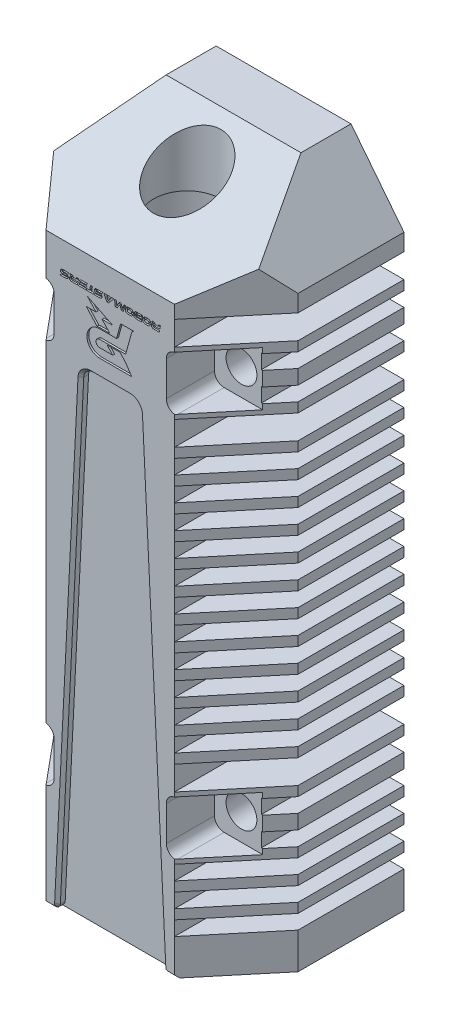
from build123d import *

# Parameters (mm, degrees)
SKETCH_1_W             = 25
SKETCH_1_H             = 20
EXTRUDE_2_DEPTH        = 42.5
SKETCH_3_R             = 6.025
CUT_EXTRUDE_2_DEPTH    = 65
CUT_EXTRUDE_3_DEPTH    = 87.49421946
SKETCH_5_R             = 1.6
CUT_EXTRUDE_4_DEPTH    = 50
SKETCH_8_R             = 3.5
CUT_EXTRUDE_8_DEPTH    = 50
SKETCH_12_W            = 25
SKETCH_12_H            = 4
CUT_EXTRUDE_12_DEPTH   = 49.605555238
CUT_EXTRUDE_14_DEPTH   = 83.566639752
CUT_EXTRUDE_15_DEPTH   = 51.311529494
SKETCH_15_W            = 25
SKETCH_15_H            = 3
CUT_EXTRUDE_19_DEPTH   = 10
CUT_EXTRUDE_22_DEPTH   = 45.300112867
SKETCH_22_W            = 5.833333333
SKETCH_22_H            = 1.5
CUT_EXTRUDE_26_DEPTH   = 45.300112867
SKETCH_23_R            = 7
SKETCH_23_R_2          = 6.025
CUT_EXTRUDE_27_DEPTH   = 2.5
CHAMFER_2_SIZE         = 0.3
CUT_EXTRUDE_START      = -0.2
CUT_EXTRUDE_31_DEPTH   = 0.2
CUT_EXTRUDE_32_DEPTH   = 0.8
FILLET_4_R             = 1
FILLET_5_R             = 0.5
SKETCH_31_W            = 5.833333333
SKETCH_31_H            = 1
CUT_EXTRUDE_33_DEPTH   = 45.300112994
CUT_EXTRUDE_START_2    = -13
SKETCH_35_W            = 5.6
SKETCH_35_H            = 5.6
CUT_EXTRUDE_35_DEPTH   = 15
FILLET_6_R             = 1
CHAMFER_3_SIZE         = 0.3
CUT_EXTRUDE_36_DEPTH   = 4
EXTRUDE_START          = 1.5
EXTRUDE_3_DEPTH        = 1
PATTERN_LINEAR_1_COUNT = 2
PATTERN_LINEAR_1_PITCH = 2.5
CHAMFER_4_SIZE         = 0.3
SKETCH_39_W            = 1.8
SKETCH_39_H            = 1.5
CUT_EXTRUDE_37_DEPTH   = 45.300112907


# Read off the part's stored shape, not the designer's step: 切除-拉伸31
with BuildPart() as part:
    # 草图1 → 凸台-拉伸2 (new, symmetric)
    with BuildSketch(Plane(origin=(0, 0, 0), x_dir=(1, 0, 0), z_dir=(0, 1, 0))):
        Rectangle(SKETCH_1_W, SKETCH_1_H)
    extrude(amount=EXTRUDE_2_DEPTH, both=True)

    # 草图3 → 切除-拉伸2 (cut)
    with BuildSketch(Plane.XZ.offset(42.5)):
        with Locations(Location((0, 0, 0), (0, 0, 270))):
            Circle(SKETCH_3_R)
    extrude(amount=-CUT_EXTRUDE_2_DEPTH, mode=Mode.SUBTRACT)

    # 草图4 → 切除-拉伸3 (cut, through all)
    with BuildSketch(Plane.XZ.offset(42.5)):
        Polygon((5, 10), (12.5, 1), (12.5, 10), align=None)
        Polygon((-12.5, 10), (-5, 10), (-12.5, 1), align=None)
    extrude(amount=-CUT_EXTRUDE_3_DEPTH, mode=Mode.SUBTRACT)

    # 草图5 → 切除-拉伸4 (cut)
    with BuildSketch(Plane(origin=(0, 0, -10), x_dir=(-1, 0, 0), z_dir=(0, 0, -1))):
        with Locations((-8.625, -25)):
            Circle(SKETCH_5_R)
        with Locations((8.625, -25)):
            Circle(SKETCH_5_R)
        with Locations((-8.625, 15)):
            Circle(SKETCH_5_R)
        with Locations((8.625, 15)):
            Circle(SKETCH_5_R)
    extrude(amount=-CUT_EXTRUDE_4_DEPTH, mode=Mode.SUBTRACT)

    # 草图8 → 切除-拉伸8 (cut)
    with BuildSketch(Plane.XZ.offset(-22.5)):
        with Locations(Location((0, 0, 0), (0, 0, 270))):
            Circle(SKETCH_8_R)
    extrude(amount=-CUT_EXTRUDE_8_DEPTH, mode=Mode.SUBTRACT)

    # 草图12 → 切除-拉伸12 (cut, through all)
    with BuildSketch(Plane(origin=(0, 0, -10), x_dir=(-1, 0, 0), z_dir=(0, 0, -1))):
        with Locations((0, -40.5)):
            Rectangle(SKETCH_12_W, SKETCH_12_H)
    extrude(amount=-CUT_EXTRUDE_12_DEPTH, mode=Mode.SUBTRACT)

    # 草图14 → 切除-拉伸14 (cut, through all)
    with BuildSketch(Plane.XZ.offset(38.5)):
        Polygon((-6.666666667, 8), (6.666666667, 8), (5, 10), (-5, 10), align=None)
    extrude(amount=-CUT_EXTRUDE_14_DEPTH, mode=Mode.SUBTRACT)

    # 草图2 → 切除-拉伸15 (cut, through all)
    with BuildSketch(Plane.ZY.offset(12.5)):
        Polygon((-10, 32.5), (10, 20.952994616), (10, 42.5), (-10, 42.5), align=None)
    extrude(amount=-CUT_EXTRUDE_15_DEPTH, mode=Mode.SUBTRACT)

    # 草图15 → 切除-拉伸19 (cut)
    with BuildSketch(Plane(origin=(0, 0, -10), x_dir=(-1, 0, 0), z_dir=(0, 0, -1))):
        with Locations((0, 31)):
            Rectangle(SKETCH_15_W, SKETCH_15_H)
    extrude(amount=-CUT_EXTRUDE_19_DEPTH, mode=Mode.SUBTRACT)

    # 草图19 → 切除-拉伸22 (cut, through all)
    with BuildSketch(Plane(origin=(0, 0, -10), x_dir=(-1, 0, 0), z_dir=(0, 0, -1))):
        Polygon((12.5, 22.5), (7, 29.5), (12.5, 29.5), align=None)
        Polygon((-7, 29.5), (-12.5, 29.5), (-12.5, 22.5), align=None)
    extrude(amount=-CUT_EXTRUDE_22_DEPTH, mode=Mode.SUBTRACT)

    # 草图22 → 切除-拉伸26 (cut, through all)
    with BuildSketch(Plane(origin=(0, 0, -10), x_dir=(-1, 0, 0), z_dir=(0, 0, -1))):
        with Locations((9.583333334, 20)):
            Rectangle(SKETCH_22_W, SKETCH_22_H)
        with Locations((-9.583333334, -32.5)):
            Rectangle(SKETCH_22_W, SKETCH_22_H)
        with Locations((-9.583333334, -30)):
            Rectangle(SKETCH_22_W, SKETCH_22_H)
        with Locations((-9.583333334, -20)):
            Rectangle(SKETCH_22_W, SKETCH_22_H)
        with Locations((9.583333334, 10)):
            Rectangle(SKETCH_22_W, SKETCH_22_H)
        with Locations((9.583333334, 7.5)):
            Rectangle(SKETCH_22_W, SKETCH_22_H)
        with Locations((9.583333334, 5)):
            Rectangle(SKETCH_22_W, SKETCH_22_H)
        with Locations((9.583333334, 2.5)):
            Rectangle(SKETCH_22_W, SKETCH_22_H)
        with Locations((9.583333334, 0)):
            Rectangle(SKETCH_22_W, SKETCH_22_H)
        with Locations((9.583333334, -2.5)):
            Rectangle(SKETCH_22_W, SKETCH_22_H)
        with Locations((9.583333334, -5)):
            Rectangle(SKETCH_22_W, SKETCH_22_H)
        with Locations((9.583333334, -7.5)):
            Rectangle(SKETCH_22_W, SKETCH_22_H)
        with Locations((9.583333334, -10)):
            Rectangle(SKETCH_22_W, SKETCH_22_H)
        with Locations((9.583333334, -12.5)):
            Rectangle(SKETCH_22_W, SKETCH_22_H)
        with Locations((9.583333334, -15)):
            Rectangle(SKETCH_22_W, SKETCH_22_H)
        with Locations((9.583333334, -17.5)):
            Rectangle(SKETCH_22_W, SKETCH_22_H)
        with Locations((9.583333334, -20)):
            Rectangle(SKETCH_22_W, SKETCH_22_H)
        with Locations((-9.583333334, -17.5)):
            Rectangle(SKETCH_22_W, SKETCH_22_H)
        with Locations((-9.583333334, -15)):
            Rectangle(SKETCH_22_W, SKETCH_22_H)
        with Locations((-9.583333334, -12.5)):
            Rectangle(SKETCH_22_W, SKETCH_22_H)
        with Locations((9.583333334, -30)):
            Rectangle(SKETCH_22_W, SKETCH_22_H)
        with Locations((9.583333334, -32.5)):
            Rectangle(SKETCH_22_W, SKETCH_22_H)
        with Locations((-9.583333334, -10)):
            Rectangle(SKETCH_22_W, SKETCH_22_H)
        with Locations((-9.583333334, -7.5)):
            Rectangle(SKETCH_22_W, SKETCH_22_H)
        with Locations((-9.583333334, -5)):
            Rectangle(SKETCH_22_W, SKETCH_22_H)
        with Locations((-9.583333334, -2.5)):
            Rectangle(SKETCH_22_W, SKETCH_22_H)
        with Locations((-9.583333334, 0)):
            Rectangle(SKETCH_22_W, SKETCH_22_H)
        with Locations((-9.583333334, 2.5)):
            Rectangle(SKETCH_22_W, SKETCH_22_H)
        with Locations((-9.583333334, 5)):
            Rectangle(SKETCH_22_W, SKETCH_22_H)
        with Locations((-9.583333334, 7.5)):
            Rectangle(SKETCH_22_W, SKETCH_22_H)
        with Locations((-9.583333334, 10)):
            Rectangle(SKETCH_22_W, SKETCH_22_H)
        with Locations((-9.583333334, 20)):
            Rectangle(SKETCH_22_W, SKETCH_22_H)
    extrude(amount=-CUT_EXTRUDE_26_DEPTH, mode=Mode.SUBTRACT)

    # 草图23 → 切除-拉伸27 (cut)
    with BuildSketch(Plane.XZ.offset(38.5)):
        with Locations(Location((0, 0, 0), (0, 0, 270))):
            Circle(SKETCH_23_R)
        with Locations(Location((0, 0, 0), (0, 0, 270))):
            Circle(SKETCH_23_R_2, mode=Mode.SUBTRACT)
    extrude(amount=-CUT_EXTRUDE_27_DEPTH, mode=Mode.SUBTRACT)

    # 倒角2
    chamfer_2_edges = [part.edges().sort_by_distance(p)[0] for p in [
        (0, -36, 6.025),
    ]]
    chamfer(chamfer_2_edges, length=CHAMFER_2_SIZE)

    # 切除-拉伸31 outline → 切除-拉伸31 (cut)
    # profile 1 of 15: a face of its own
    with BuildSketch(Plane.XY.offset(8).offset(CUT_EXTRUDE_START)):
        with BuildLine():
            add(Edge.make_bspline(
                [(-1.099282272, 14.323427495), (-1.30829985, 14.323427495), (-1.477754427, 14.492875997), (-1.477754427, 14.701898427)],
                knots=[9, 9, 9, 9, 10, 10, 10, 10], degree=3))
            add(Edge.make_bspline(
                [(-1.477754427, 14.701898427), (-1.477754427, 14.91092693), (-1.30829985, 15.080369359), (-1.099282272, 15.080369359)],
                knots=[10, 10, 10, 10, 11, 11, 11, 11], degree=3))
            Line((-1.099282272, 15.080369359), (1.602752033, 15.080369359))
            Line((1.602752033, 15.080369359), (1.602752033, 15.081703953))
            Line((1.602752033, 15.081703953), (2.259711089, 17.46563608))
            Line((2.259711089, 17.46563608), (2.479079968, 17.568193372))
            Line((2.479079968, 17.568193372), (1.07858083, 17.568193372))
            Line((1.07858083, 17.568193372), (0.653207228, 16.024631626))
            Line((0.653207228, 16.024631626), (-1.099282272, 16.024631626))
            add(Edge.make_bspline(
                [(-1.099282272, 16.024631626), (-1.829803079, 16.024631626), (-2.422010646, 15.432423854), (-2.422010646, 14.701898427)],
                knots=[22, 22, 22, 22, 23, 23, 23, 23], degree=3))
            add(Edge.make_bspline(
                [(-2.422010646, 14.701898427), (-2.422010646, 13.971371566), (-1.829803079, 13.379164015), (-1.099282272, 13.379164015)],
                knots=[0, 0, 0, 0, 1, 1, 1, 1], degree=3))
            Line((-1.099282272, 13.379164015), (2.228864845, 13.379164015))
            Line((2.228864845, 13.379164015), (1.602753888, 14.323418627))
            Line((1.602753888, 14.323418627), (1.014493602, 14.967559131))
            Line((1.014493602, 14.967559131), (-0.33171464, 14.967559131))
            Line((-0.33171464, 14.967559131), (0.254433214, 14.323427495))
            Line((0.254433214, 14.323427495), (-1.099282272, 14.323427495))
        make_face()
    # profile 2 of 15: a face of its own
    with BuildSketch(Plane.XY.offset(8).offset(CUT_EXTRUDE_START)):
        with BuildLine():
            add(Edge.make_bspline(
                [(-4.051841364, 19.271206915), (-4.062965005, 19.283932311), (-4.077422094, 19.301405899), (-4.095234492, 19.323648322)],
                knots=[25, 25, 25, 25, 26, 26, 26, 26], degree=3))
            add(Edge.make_bspline(
                [(-4.021814821, 19.239744862), (-4.030708876, 19.248011211), (-4.040717723, 19.258499735), (-4.051841364, 19.271206915)],
                knots=[24, 24, 24, 24, 25, 25, 25, 25], degree=3))
            add(Edge.make_bspline(
                [(-4.105716944, 19.209231481), (-4.080291653, 19.223859796), (-4.052328327, 19.234022869), (-4.021814821, 19.239744862)],
                knots=[23, 23, 23, 23, 24, 24, 24, 24], degree=3))
            add(Edge.make_bspline(
                [(-4.17102583, 19.15584165), (-4.152917126, 19.176815055), (-4.131131306, 19.194615309), (-4.105716944, 19.209231481)],
                knots=[22, 22, 22, 22, 23, 23, 23, 23], degree=3))
            add(Edge.make_bspline(
                [(-4.212982356, 19.085286683), (-4.20311559, 19.111358018), (-4.189146677, 19.134869459), (-4.17102583, 19.15584165)],
                knots=[21, 21, 21, 21, 22, 22, 22, 22], degree=3))
            add(Edge.make_bspline(
                [(-4.227758825, 19.003286267), (-4.227758825, 19.031890781), (-4.222826049, 19.059226277), (-4.212982356, 19.085286683)],
                knots=[20, 20, 20, 20, 21, 21, 21, 21], degree=3))
            add(Edge.make_bspline(
                [(-4.201064517, 18.908900479), (-4.218852627, 18.933685795), (-4.227758825, 18.965147724), (-4.227758825, 19.003286267)],
                knots=[19, 19, 19, 19, 20, 20, 20, 20], degree=3))
            add(Edge.make_bspline(
                [(-4.131937648, 18.84930764), (-4.160209425, 18.864250478), (-4.183264263, 18.88410909), (-4.201064517, 18.908900479)],
                knots=[18, 18, 18, 18, 19, 19, 19, 19], degree=3))
            add(Edge.make_bspline(
                [(-4.037551858, 18.81832053), (-4.072179654, 18.824042647), (-4.103641584, 18.834376946), (-4.131937648, 18.84930764)],
                knots=[17, 17, 17, 17, 18, 18, 18, 18], degree=3))
            add(Edge.make_bspline(
                [(-3.936002491, 18.809739783), (-3.969052819, 18.809739783), (-4.00289856, 18.812598413), (-4.037551858, 18.81832053)],
                knots=[16, 16, 16, 16, 17, 17, 17, 17], degree=3))
            Line((-3.936002491, 18.809739783), (-3.396709937, 18.809739783))
            Line((-3.396709937, 18.809739783), (-3.367749612, 18.975637463))
            Line((-3.367749612, 18.975637463), (-3.922648051, 18.975637463))
            add(Edge.make_bspline(
                [(-3.99415873, 18.991374499), (-3.97699845, 18.980878689), (-3.953161557, 18.975637463), (-3.922648051, 18.975637463)],
                knots=[12, 12, 12, 12, 13, 13, 13, 13], degree=3))
            add(Edge.make_bspline(
                [(-4.019904615, 19.038567394), (-4.019904615, 19.017589131), (-4.01131901, 19.001856952), (-3.99415873, 18.991374499)],
                knots=[11, 11, 11, 11, 12, 12, 12, 12], degree=3))
            add(Edge.make_bspline(
                [(-4.009895767, 19.073367629), (-4.01657238, 19.062877891), (-4.019904615, 19.051286589), (-4.019904615, 19.038567394)],
                knots=[10, 10, 10, 10, 11, 11, 11, 11], degree=3))
            add(Edge.make_bspline(
                [(-3.983201458, 19.099588333), (-3.994312955, 19.092597197), (-4.003219154, 19.083857368), (-4.009895767, 19.073367629)],
                knots=[9, 9, 9, 9, 10, 10, 10, 10], degree=3))
            add(Edge.make_bspline(
                [(-3.944101133, 19.115793989), (-3.959031827, 19.111980863), (-3.972065674, 19.106591611), (-3.983201458, 19.099588333)],
                knots=[8, 8, 8, 8, 9, 9, 9, 9], degree=3))
            add(Edge.make_bspline(
                [(-3.89691431, 19.121516234), (-3.913434616, 19.121516234), (-3.929159509, 19.119606028), (-3.944101133, 19.115793989)],
                knots=[7, 7, 7, 7, 8, 8, 8, 8], degree=3))
            Line((-3.89691431, 19.121516234), (-3.342003727, 19.121516234))
            Line((-3.342003727, 19.121516234), (-3.284795912, 19.447599191))
            Line((-3.284795912, 19.447599191), (-3.482166456, 19.447599191))
            Line((-3.482166456, 19.447599191), (-3.511719394, 19.278838024))
            Line((-3.511719394, 19.278838024), (-3.814919963, 19.278838024))
            Line((-3.814919963, 19.278838024), (-3.927427816, 19.447599191))
            Line((-3.927427816, 19.447599191), (-4.191529274, 19.447599191))
            Line((-4.191529274, 19.447599191), (-4.095234492, 19.323648322))
        make_face()
    # profile 3 of 15: a face of its own
    with BuildSketch(Plane.XY.offset(8).offset(CUT_EXTRUDE_START)):
        with BuildLine():
            add(Edge.make_bspline(
                [(-4.541396915, 19.028077655), (-4.541396915, 19.052241213), (-4.561723061, 19.064307206), (-4.602411784, 19.064307206)],
                knots=[24, 24, 24, 24, 25, 25, 25, 25], degree=3))
            add(Edge.make_bspline(
                [(-4.559517763, 18.987555302), (-4.547433554, 18.995513077), (-4.541396915, 19.009008384), (-4.541396915, 19.028077655)],
                knots=[23, 23, 23, 23, 24, 24, 24, 24], degree=3))
            add(Edge.make_bspline(
                [(-4.617674001, 18.975637463), (-4.590967549, 18.975637463), (-4.571577683, 18.979615743), (-4.559517763, 18.987555302)],
                knots=[22, 22, 22, 22, 23, 23, 23, 23], degree=3))
            Line((-4.617674001, 18.975637463), (-5.060065802, 18.975637463))
            Line((-5.060065802, 18.975637463), (-5.216440387, 18.809739783))
            Line((-5.216440387, 18.809739783), (-4.662478228, 18.809739783))
            add(Edge.make_bspline(
                [(-4.519458084, 18.826900062), (-4.558865645, 18.8154619), (-4.606538217, 18.809739783), (-4.662478228, 18.809739783)],
                knots=[18, 18, 18, 18, 19, 19, 19, 19], degree=3))
            add(Edge.make_bspline(
                [(-4.422687268, 18.875048667), (-4.44779318, 18.854401927), (-4.480049309, 18.838338225), (-4.519458084, 18.826900062)],
                knots=[17, 17, 17, 17, 18, 18, 18, 18], degree=3))
            add(Edge.make_bspline(
                [(-4.367863264, 18.947512626), (-4.379306285, 18.919863822), (-4.397569214, 18.895712407), (-4.422687268, 18.875048667)],
                knots=[16, 16, 16, 16, 17, 17, 17, 17], degree=3))
            add(Edge.make_bspline(
                [(-4.350702984, 19.037612768), (-4.350702984, 19.005195258), (-4.35641903, 18.975162644), (-4.367863264, 18.947512626)],
                knots=[15, 15, 15, 15, 16, 16, 16, 16], degree=3))
            add(Edge.make_bspline(
                [(-4.401234186, 19.149164911), (-4.36754267, 19.121207783), (-4.350702984, 19.084017665), (-4.350702984, 19.037612768)],
                knots=[14, 14, 14, 14, 15, 15, 15, 15], degree=3))
            add(Edge.make_bspline(
                [(-4.560466187, 19.191116705), (-4.48799494, 19.191116705), (-4.434913558, 19.177140507), (-4.401234186, 19.149164911)],
                knots=[13, 13, 13, 13, 14, 14, 14, 14], degree=3))
            Line((-4.560466187, 19.191116705), (-4.908470982, 19.191116705))
            add(Edge.make_bspline(
                [(-4.968537427, 19.229255247), (-4.968537427, 19.203842101), (-4.948519732, 19.191116705), (-4.908470982, 19.191116705)],
                knots=[11, 11, 11, 11, 12, 12, 12, 12], degree=3))
            add(Edge.make_bspline(
                [(-4.950416579, 19.270258491), (-4.962489858, 19.261364437), (-4.968537427, 19.247702761), (-4.968537427, 19.229255247)],
                knots=[10, 10, 10, 10, 11, 11, 11, 11], degree=3))
            add(Edge.make_bspline(
                [(-4.892260341, 19.283605645), (-4.918954649, 19.283605645), (-4.938344515, 19.279158618), (-4.950416579, 19.270258491)],
                knots=[9, 9, 9, 9, 10, 10, 10, 10], degree=3))
            Line((-4.892260341, 19.283605645), (-4.408859223, 19.283605645))
            Line((-4.408859223, 19.283605645), (-4.253458564, 19.447599191))
            Line((-4.253458564, 19.447599191), (-4.847456114, 19.447599191))
            add(Edge.make_bspline(
                [(-4.991899501, 19.429959235), (-4.95217256, 19.441728921), (-4.904011811, 19.447599191), (-4.847456114, 19.447599191)],
                knots=[5, 5, 5, 5, 6, 6, 6, 6], degree=3))
            add(Edge.make_bspline(
                [(-5.089156065, 19.380376459), (-5.064039225, 19.401681267), (-5.031616727, 19.418200479), (-4.991899501, 19.429959235)],
                knots=[4, 4, 4, 4, 5, 5, 5, 5], degree=3))
            add(Edge.make_bspline(
                [(-5.14396914, 19.304579051), (-5.132524905, 19.333823538), (-5.114249833, 19.359088531), (-5.089156065, 19.380376459)],
                knots=[3, 3, 3, 3, 4, 4, 4, 4], degree=3))
            add(Edge.make_bspline(
                [(-5.16112942, 19.209231481), (-5.16112942, 19.243557987), (-5.155413375, 19.275345492), (-5.14396914, 19.304579051)],
                knots=[2, 2, 2, 2, 3, 3, 3, 3], degree=3))
            add(Edge.make_bspline(
                [(-5.107264769, 19.101017647), (-5.143174941, 19.125494514), (-5.16112942, 19.161557696), (-5.16112942, 19.209231481)],
                knots=[1, 1, 1, 1, 2, 2, 2, 2], degree=3))
            add(Edge.make_bspline(
                [(-4.949468156, 19.064307206), (-5.018749249, 19.064307206), (-5.071343668, 19.076557654), (-5.107264769, 19.101017647)],
                knots=[0, 0, 0, 0, 1, 1, 1, 1], degree=3))
            Line((-4.949468156, 19.064307206), (-4.602411784, 19.064307206))
        make_face()
    # profile 4 of 15: a face of its own
    with BuildSketch(Plane.XY.offset(8).offset(CUT_EXTRUDE_START)):
        with BuildLine():
            Line((-2.492406533, 17.342005804), (-1.372398007, 16.11119666))
            add(Edge.make_bspline(
                [(-1.372398007, 16.11119666), (-1.283940777, 16.128309782), (-1.192661348, 16.137435782), (-1.099271342, 16.137435782)],
                knots=[1, 1, 1, 1, 2, 2, 2, 2], degree=3))
            Line((-1.099271342, 16.137435782), (-0.053915075, 16.137435782))
            Line((-0.053915075, 16.137435782), (-0.85113158, 17.010365703))
            Line((-0.85113158, 17.010365703), (0.260896098, 17.010365703))
            Line((0.260896098, 17.010365703), (-2.36886976, 18.308005315))
            Line((-2.36886976, 18.308005315), (-1.476022734, 17.342005804))
            Line((-1.476022734, 17.342005804), (-2.492406533, 17.342005804))
        make_face()
    # profile 5 of 15: a face of its own
    with BuildSketch(Plane.XY.offset(8).offset(CUT_EXTRUDE_START)):
        with BuildLine():
            add(Edge.make_bspline(
                [(4.43606837, 19.271206915), (4.424955659, 19.283932311), (4.41048764, 19.301405899), (4.392675243, 19.323648322)],
                knots=[25, 25, 25, 25, 26, 26, 26, 26], degree=3))
            add(Edge.make_bspline(
                [(4.466094914, 19.239744862), (4.457200859, 19.248011211), (4.447192011, 19.258499735), (4.43606837, 19.271206915)],
                knots=[24, 24, 24, 24, 25, 25, 25, 25], degree=3))
            add(Edge.make_bspline(
                [(4.382191576, 19.209231481), (4.407630225, 19.223859796), (4.435581408, 19.234022869), (4.466094914, 19.239744862)],
                knots=[23, 23, 23, 23, 24, 24, 24, 24], degree=3))
            add(Edge.make_bspline(
                [(4.316883905, 19.15584165), (4.334992609, 19.176815055), (4.356778429, 19.194615309), (4.382191576, 19.209231481)],
                knots=[22, 22, 22, 22, 23, 23, 23, 23], degree=3))
            add(Edge.make_bspline(
                [(4.274926164, 19.085286683), (4.28479293, 19.111358018), (4.298763057, 19.134869459), (4.316883905, 19.15584165)],
                knots=[21, 21, 21, 21, 22, 22, 22, 22], degree=3))
            add(Edge.make_bspline(
                [(4.260149695, 19.003286267), (4.260149695, 19.031890781), (4.265083685, 19.059226277), (4.274926164, 19.085286683)],
                knots=[20, 20, 20, 20, 21, 21, 21, 21], degree=3))
            add(Edge.make_bspline(
                [(4.286845218, 18.908900479), (4.269055893, 18.933685795), (4.260149695, 18.965147724), (4.260149695, 19.003286267)],
                knots=[19, 19, 19, 19, 20, 20, 20, 20], degree=3))
            add(Edge.make_bspline(
                [(4.355972086, 18.84930764), (4.327699095, 18.864250478), (4.304657615, 18.88410909), (4.286845218, 18.908900479)],
                knots=[18, 18, 18, 18, 19, 19, 19, 19], degree=3))
            add(Edge.make_bspline(
                [(4.450357877, 18.81832053), (4.415730081, 18.824042647), (4.384266936, 18.834376946), (4.355972086, 18.84930764)],
                knots=[17, 17, 17, 17, 18, 18, 18, 18], degree=3))
            add(Edge.make_bspline(
                [(4.551907243, 18.809739783), (4.518867845, 18.809739783), (4.48500996, 18.812598413), (4.450357877, 18.81832053)],
                knots=[16, 16, 16, 16, 17, 17, 17, 17], degree=3))
            Line((4.551907243, 18.809739783), (5.091899275, 18.809739783))
            Line((5.091899275, 18.809739783), (5.120160416, 18.975637463))
            Line((5.120160416, 18.975637463), (4.565260469, 18.975637463))
            add(Edge.make_bspline(
                [(4.493751004, 18.991374499), (4.51091007, 18.980878689), (4.534746963, 18.975637463), (4.565260469, 18.975637463)],
                knots=[12, 12, 12, 12, 13, 13, 13, 13], degree=3))
            add(Edge.make_bspline(
                [(4.468003905, 19.038567394), (4.468003905, 19.017589131), (4.476590724, 19.001856952), (4.493751004, 18.991374499)],
                knots=[11, 11, 11, 11, 12, 12, 12, 12], degree=3))
            add(Edge.make_bspline(
                [(4.478013968, 19.073367629), (4.471337354, 19.062877891), (4.468003905, 19.051286589), (4.468003905, 19.038567394)],
                knots=[10, 10, 10, 10, 11, 11, 11, 11], degree=3))
            add(Edge.make_bspline(
                [(4.504708276, 19.099588333), (4.493596779, 19.092597197), (4.484690581, 19.083857368), (4.478013968, 19.073367629)],
                knots=[9, 9, 9, 9, 10, 10, 10, 10], degree=3))
            add(Edge.make_bspline(
                [(4.543807387, 19.115793989), (4.528876693, 19.111980863), (4.515844061, 19.106591611), (4.504708276, 19.099588333)],
                knots=[8, 8, 8, 8, 9, 9, 9, 9], degree=3))
            add(Edge.make_bspline(
                [(4.590995425, 19.121516234), (4.574475425, 19.121516234), (4.558750225, 19.119606028), (4.543807387, 19.115793989)],
                knots=[7, 7, 7, 7, 8, 8, 8, 8], degree=3))
            Line((4.590995425, 19.121516234), (5.1459063, 19.121516234))
            Line((5.1459063, 19.121516234), (5.203114113, 19.447599191))
            Line((5.203114113, 19.447599191), (5.005755718, 19.447599191))
            Line((5.005755718, 19.447599191), (4.976190636, 19.278838024))
            Line((4.976190636, 19.278838024), (4.672988861, 19.278838024))
            Line((4.672988861, 19.278838024), (4.560494062, 19.447599191))
            Line((4.560494062, 19.447599191), (4.296379246, 19.447599191))
            Line((4.296379246, 19.447599191), (4.392675243, 19.323648322))
        make_face()
    # profile 6 of 15: a face of its own
    with BuildSketch(Plane.XY.offset(8).offset(CUT_EXTRUDE_START)):
        with BuildLine():
            Line((3.915536638, 19.448310813), (3.73038024, 19.448310813))
            add(Edge.make_bspline(
                [(3.73038024, 19.448310813), (3.549149905, 19.448310813), (3.387712606, 19.30700415), (3.369805488, 19.132699378)],
                knots=[5, 5, 5, 5, 6, 6, 6, 6], degree=3))
            Line((3.369805488, 19.132699378), (3.368773272, 19.122577594))
            add(Edge.make_bspline(
                [(3.368773272, 19.122577594), (3.350866154, 18.94826675), (3.483272693, 18.806964945), (3.664515173, 18.806964945)],
                knots=[7, 7, 7, 7, 8, 8, 8, 8], degree=3))
            Line((3.664515173, 18.806964945), (3.849659427, 18.806964945))
            add(Edge.make_bspline(
                [(3.849659427, 18.806964945), (4.030901906, 18.806964945), (4.192328275, 18.94826675), (4.210235394, 19.122577594)],
                knots=[1, 1, 1, 1, 2, 2, 2, 2], degree=3))
            Line((4.210235394, 19.122577594), (4.211278538, 19.132699378))
            add(Edge.make_bspline(
                [(4.211278538, 19.132699378), (4.229174727, 19.30700415), (4.096766973, 19.448310813), (3.915536638, 19.448310813)],
                knots=[3, 3, 3, 3, 4, 4, 4, 4], degree=3))
        make_face()
        with BuildLine():
            Line((4.003946507, 19.130007117), (4.003459545, 19.125268641))
            add(Edge.make_bspline(
                [(4.003459545, 19.125268641), (3.995075525, 19.043631321), (3.919473629, 18.977457805), (3.834586651, 18.977457805)],
                knots=[5, 5, 5, 5, 6, 6, 6, 6], degree=3))
            Line((3.834586651, 18.977457805), (3.714607986, 18.977457805))
            add(Edge.make_bspline(
                [(3.714607986, 18.977457805), (3.629731937, 18.977457805), (3.567721284, 19.043631321), (3.576105303, 19.125268641)],
                knots=[7, 7, 7, 7, 8, 8, 8, 8], degree=3))
            Line((3.576105303, 19.125268641), (3.576592266, 19.130007117))
            add(Edge.make_bspline(
                [(3.576592266, 19.130007117), (3.584976285, 19.211644311), (3.660578181, 19.277817952), (3.745453016, 19.277817952)],
                knots=[1, 1, 1, 1, 2, 2, 2, 2], degree=3))
            Line((3.745453016, 19.277817952), (3.865443824, 19.277817952))
            add(Edge.make_bspline(
                [(3.865443824, 19.277817952), (3.950319873, 19.277817952), (4.012330526, 19.211644311), (4.003946507, 19.130007117)],
                knots=[3, 3, 3, 3, 4, 4, 4, 4], degree=3))
        make_face(mode=Mode.SUBTRACT)
    # profile 7 of 15: a face of its own
    with BuildSketch(Plane.XY.offset(8).offset(CUT_EXTRUDE_START)):
        with BuildLine():
            add(Edge.make_bspline(
                [(2.539833747, 19.100063152), (2.553176044, 19.108642684), (2.566849864, 19.115171144), (2.58083092, 19.119606028)],
                knots=[21, 21, 21, 21, 22, 22, 22, 22], degree=3))
            add(Edge.make_bspline(
                [(2.503605409, 19.067165836), (2.514408456, 19.080519061), (2.526480521, 19.091482277), (2.539833747, 19.100063152)],
                knots=[20, 20, 20, 20, 21, 21, 21, 21], degree=3))
            add(Edge.make_bspline(
                [(2.477384706, 19.020446546), (2.484049175, 19.038252871), (2.492801148, 19.053823539), (2.503605409, 19.067165836)],
                knots=[19, 19, 19, 19, 20, 20, 20, 20], degree=3))
            add(Edge.make_bspline(
                [(2.467375858, 18.959431548), (2.467375858, 18.982308004), (2.470708092, 19.002663164), (2.477384706, 19.020446546)],
                knots=[18, 18, 18, 18, 19, 19, 19, 19], degree=3))
            add(Edge.make_bspline(
                [(2.526006916, 18.847398649), (2.486907805, 18.872516703), (2.467375858, 18.90984877), (2.467375858, 18.959431548)],
                knots=[17, 17, 17, 17, 18, 18, 18, 18], degree=3))
            add(Edge.make_bspline(
                [(2.688571151, 18.809739783), (2.619290057, 18.809739783), (2.565093883, 18.822292603), (2.526006916, 18.847398649)],
                knots=[16, 16, 16, 16, 17, 17, 17, 17], degree=3))
            Line((2.688571151, 18.809739783), (3.24689776, 18.809739783))
            Line((3.24689776, 18.809739783), (3.274943664, 18.975637463))
            Line((3.274943664, 18.975637463), (2.710499052, 18.975637463))
            add(Edge.make_bspline(
                [(2.676653311, 18.982787681), (2.686507934, 18.978020059), (2.6977858, 18.975637463), (2.710499052, 18.975637463)],
                knots=[12, 12, 12, 12, 13, 13, 13, 13], degree=3))
            add(Edge.make_bspline(
                [(2.661876842, 19.009008384), (2.661876842, 18.996301203), (2.666797474, 18.987555302), (2.676653311, 18.982787681)],
                knots=[11, 11, 11, 11, 12, 12, 12, 12], degree=3))
            add(Edge.make_bspline(
                [(2.68093397, 19.048576241), (2.668232861, 19.041276656), (2.661876842, 19.028077655), (2.661876842, 19.009008384)],
                knots=[10, 10, 10, 10, 11, 11, 11, 11], degree=3))
            add(Edge.make_bspline(
                [(2.724800703, 19.059539584), (2.708280396, 19.059539584), (2.693658152, 19.055892828), (2.68093397, 19.048576241)],
                knots=[9, 9, 9, 9, 10, 10, 10, 10], degree=3))
            Line((2.724800703, 19.059539584), (3.289246528, 19.059539584))
            Line((3.289246528, 19.059539584), (3.357886434, 19.447599191))
            Line((3.357886434, 19.447599191), (2.797259806, 19.447599191))
            add(Edge.make_bspline(
                [(2.648522402, 19.42900462), (2.686662159, 19.441397398), (2.736244937, 19.447599191), (2.797259806, 19.447599191)],
                knots=[5, 5, 5, 5, 6, 6, 6, 6], degree=3))
            add(Edge.make_bspline(
                [(2.558429414, 19.380376459), (2.580345171, 19.400400226), (2.610383858, 19.416610867), (2.648522402, 19.42900462)],
                knots=[4, 4, 4, 4, 5, 5, 5, 5], degree=3))
            add(Edge.make_bspline(
                [(2.513614257, 19.312683764), (2.521570818, 19.337801818), (2.536490583, 19.360357549), (2.558429414, 19.380376459)],
                knots=[3, 3, 3, 3, 4, 4, 4, 4], degree=3))
            add(Edge.make_bspline(
                [(2.501695203, 19.235931736), (2.501695203, 19.261998338), (2.505668626, 19.287578945), (2.513614257, 19.312683764)],
                knots=[2, 2, 2, 2, 3, 3, 3, 3], degree=3))
            add(Edge.make_bspline(
                [(2.524097924, 19.159654776), (2.50916723, 19.179364021), (2.501695203, 19.204796597), (2.501695203, 19.235931736)],
                knots=[1, 1, 1, 1, 2, 2, 2, 2], degree=3))
            add(Edge.make_bspline(
                [(2.58083092, 19.119606028), (2.557943665, 19.126609306), (2.539039548, 19.13995646), (2.524097924, 19.159654776)],
                knots=[0, 0, 0, 0, 1, 1, 1, 1], degree=3))
        make_face()
        with BuildLine():
            add(Edge.make_bspline(
                [(2.697156756, 19.232119949), (2.697156756, 19.207968534), (2.715586054, 19.195884327), (2.752455579, 19.195884327)],
                knots=[4, 4, 4, 4, 5, 5, 5, 5], degree=3))
            add(Edge.make_bspline(
                [(2.714304892, 19.270258491), (2.702872801, 19.261364437), (2.697156756, 19.248657256), (2.697156756, 19.232119949)],
                knots=[3, 3, 3, 3, 4, 4, 4, 4], degree=3))
            add(Edge.make_bspline(
                [(2.767706867, 19.283605645), (2.74354938, 19.283605645), (2.725749126, 19.279158618), (2.714304892, 19.270258491)],
                knots=[2, 2, 2, 2, 3, 3, 3, 3], degree=3))
            Line((2.767706867, 19.283605645), (3.130962952, 19.283605645))
            Line((3.130962952, 19.283605645), (3.115711663, 19.195884327))
            Line((3.115711663, 19.195884327), (2.752455579, 19.195884327))
        make_face(mode=Mode.SUBTRACT)
    # profile 8 of 15: a face of its own
    with BuildSketch(Plane.XY.offset(8).offset(CUT_EXTRUDE_START)):
        with BuildLine():
            Line((2.114863316, 19.448310813), (1.929719062, 19.448310813))
            add(Edge.make_bspline(
                [(1.929719062, 19.448310813), (1.748476583, 19.448310813), (1.587051428, 19.30700415), (1.569144309, 19.132699378)],
                knots=[5, 5, 5, 5, 6, 6, 6, 6], degree=3))
            Line((1.569144309, 19.132699378), (1.56809995, 19.122577594))
            add(Edge.make_bspline(
                [(1.56809995, 19.122577594), (1.550204975, 18.94826675), (1.682611515, 18.806964945), (1.863853994, 18.806964945)],
                knots=[7, 7, 7, 7, 8, 8, 8, 8], degree=3))
            Line((1.863853994, 18.806964945), (2.048998248, 18.806964945))
            add(Edge.make_bspline(
                [(2.048998248, 18.806964945), (2.230240728, 18.806964945), (2.391667097, 18.94826675), (2.409574215, 19.122577594)],
                knots=[1, 1, 1, 1, 2, 2, 2, 2], degree=3))
            Line((2.409574215, 19.122577594), (2.41061736, 19.132699378))
            add(Edge.make_bspline(
                [(2.41061736, 19.132699378), (2.428513549, 19.30700415), (2.296105795, 19.448310813), (2.114863316, 19.448310813)],
                knots=[3, 3, 3, 3, 4, 4, 4, 4], degree=3))
        make_face()
        with BuildLine():
            Line((2.203285329, 19.130007117), (2.202798366, 19.125268641))
            add(Edge.make_bspline(
                [(2.202798366, 19.125268641), (2.194402204, 19.043631321), (2.118801522, 18.977457805), (2.033925473, 18.977457805)],
                knots=[5, 5, 5, 5, 6, 6, 6, 6], degree=3))
            Line((2.033925473, 18.977457805), (1.913946808, 18.977457805))
            add(Edge.make_bspline(
                [(1.913946808, 18.977457805), (1.82905983, 18.977457805), (1.767047962, 19.043631321), (1.775433195, 19.125268641)],
                knots=[7, 7, 7, 7, 8, 8, 8, 8], degree=3))
            Line((1.775433195, 19.125268641), (1.775918944, 19.130007117))
            add(Edge.make_bspline(
                [(1.775918944, 19.130007117), (1.784302963, 19.211644311), (1.859917003, 19.277817952), (1.944791838, 19.277817952)],
                knots=[1, 1, 1, 1, 2, 2, 2, 2], degree=3))
            Line((1.944791838, 19.277817952), (2.064770502, 19.277817952))
            add(Edge.make_bspline(
                [(2.064770502, 19.277817952), (2.149658695, 19.277817952), (2.211669348, 19.211644311), (2.203285329, 19.130007117)],
                knots=[3, 3, 3, 3, 4, 4, 4, 4], degree=3))
        make_face(mode=Mode.SUBTRACT)
    # profile 9 of 15: a face of its own
    with BuildSketch(Plane.XY.offset(8).offset(CUT_EXTRUDE_START)):
        with BuildLine():
            add(Edge.make_bspline(
                [(0.70201888, 19.084811864), (0.694073249, 19.073053107), (0.686613367, 19.06144979), (0.679617374, 19.050005556)],
                knots=[42, 42, 42, 42, 43, 43, 43, 43], degree=3))
            add(Edge.make_bspline(
                [(0.679617374, 19.050005556), (0.67898833, 19.076078106), (0.677707168, 19.102772414), (0.675798176, 19.130095766)],
                knots=[43, 43, 43, 43, 44, 44, 44, 44], degree=3))
            add(Edge.make_bspline(
                [(0.675798176, 19.130095766), (0.673901329, 19.157437334), (0.671363293, 19.189213785), (0.668173139, 19.225443336)],
                knots=[44, 44, 44, 44, 45, 45, 45, 45], degree=3))
            Line((0.668173139, 19.225443336), (0.646245238, 19.447599191))
            Line((0.646245238, 19.447599191), (0.449835262, 19.447599191))
            Line((0.449835262, 19.447599191), (0.498967508, 19.009839014))
            Line((0.498967508, 19.009839014), (0.521393302, 18.809739783))
            Line((0.521393302, 18.809739783), (0.774916372, 18.809739783))
            Line((0.774916372, 18.809739783), (0.735378873, 18.87785265))
            Line((0.735378873, 18.87785265), (0.861724486, 19.048101422))
            add(Edge.make_bspline(
                [(0.861724486, 19.048101422), (0.880165927, 19.072887953), (0.896211414, 19.094506061), (0.909873091, 19.112935487)],
                knots=[9, 9, 9, 9, 10, 10, 10, 10], degree=3))
            add(Edge.make_bspline(
                [(0.909873091, 19.112935487), (0.923546911, 19.131376928), (0.935618976, 19.148062388), (0.946102643, 19.16298701)],
                knots=[10, 10, 10, 10, 11, 11, 11, 11], degree=3))
            add(Edge.make_bspline(
                [(0.946102643, 19.16298701), (0.956597239, 19.17793592), (0.965978257, 19.191283074), (0.974232338, 19.203034419)],
                knots=[11, 11, 11, 11, 12, 12, 12, 12], degree=3))
            add(Edge.make_bspline(
                [(0.974232338, 19.203034419), (0.982498563, 19.214805444), (0.9901236, 19.226397832), (0.997108664, 19.237835994)],
                knots=[12, 12, 12, 12, 13, 13, 13, 13], degree=3))
            add(Edge.make_bspline(
                [(0.997108664, 19.237835994), (1.0041168, 19.216234635), (1.013319305, 19.190014056), (1.02476354, 19.159173885)],
                knots=[13, 13, 13, 13, 14, 14, 14, 14], degree=3))
            add(Edge.make_bspline(
                [(1.02476354, 19.159173885), (1.036195631, 19.128351929), (1.050190045, 19.091007586), (1.066709137, 19.047146926)],
                knots=[14, 14, 14, 14, 15, 15, 15, 15], degree=3))
            Line((1.066709137, 19.047146926), (1.081118866, 19.009839014))
            Line((1.081118866, 19.009839014), (1.156873773, 18.809739783))
            Line((1.156873773, 18.809739783), (1.415330833, 18.809739783))
            Line((1.415330833, 18.809739783), (1.364906496, 18.896619543))
            Line((1.364906496, 18.896619543), (1.623529925, 19.447599191))
            Line((1.623529925, 19.447599191), (1.429977365, 19.447599191))
            Line((1.429977365, 19.447599191), (1.330823953, 19.225443336))
            add(Edge.make_bspline(
                [(1.330823953, 19.225443336), (1.316212638, 19.191116705), (1.302550962, 19.159173885), (1.28982678, 19.129620947)],
                knots=[27, 27, 27, 27, 28, 28, 28, 28], degree=3))
            add(Edge.make_bspline(
                [(1.28982678, 19.129620947), (1.277113527, 19.100063152), (1.265977743, 19.07353387), (1.256454644, 19.050005556)],
                knots=[28, 28, 28, 28, 29, 29, 29, 29], degree=3))
            add(Edge.make_bspline(
                [(1.256454644, 19.050005556), (1.253276634, 19.060826818), (1.249944399, 19.071938314), (1.246445796, 19.083382421)],
                knots=[29, 29, 29, 29, 30, 30, 30, 30], degree=3))
            add(Edge.make_bspline(
                [(1.246445796, 19.083382421), (1.242947192, 19.094820711), (1.238974984, 19.107373666), (1.234527956, 19.121035343)],
                knots=[30, 30, 30, 30, 31, 31, 31, 31], degree=3))
            add(Edge.make_bspline(
                [(1.234527956, 19.121035343), (1.230080929, 19.134715234), (1.224838488, 19.150119533), (1.21879092, 19.167279813)],
                knots=[31, 31, 31, 31, 32, 32, 32, 32], degree=3))
            add(Edge.make_bspline(
                [(1.21879092, 19.167279813), (1.21275428, 19.184446164), (1.205923442, 19.203842101), (1.198286261, 19.225443336)],
                knots=[32, 32, 32, 32, 33, 33, 33, 33], degree=3))
            Line((1.198286261, 19.225443336), (1.143805924, 19.378922856))
            Line((1.143805924, 19.378922856), (1.119956887, 19.447599191))
            Line((1.119956887, 19.447599191), (0.9572615, 19.447599191))
            Line((0.9572615, 19.447599191), (0.914972236, 19.3876639))
            add(Edge.make_bspline(
                [(0.914972236, 19.3876639), (0.914700217, 19.387283802), (0.914439127, 19.386958351), (0.914165893, 19.386572181)],
                knots=[37, 37, 37, 37, 38, 38, 38, 38], degree=3))
            Line((0.914165893, 19.386572181), (0.800698687, 19.226397832))
            add(Edge.make_bspline(
                [(0.800698687, 19.226397832), (0.786087373, 19.205418355), (0.772900515, 19.186681822), (0.761135687, 19.170138442)],
                knots=[39, 39, 39, 39, 40, 40, 40, 40], degree=3))
            add(Edge.make_bspline(
                [(0.761135687, 19.170138442), (0.749372073, 19.153618137), (0.738579955, 19.138201694), (0.728713189, 19.12389883)],
                knots=[40, 40, 40, 40, 41, 41, 41, 41], degree=3))
            add(Edge.make_bspline(
                [(0.728713189, 19.12389883), (0.71887071, 19.10959718), (0.709976655, 19.096575478), (0.70201888, 19.084811864)],
                knots=[41, 41, 41, 41, 42, 42, 42, 42], degree=3))
        make_face()
    # profile 10 of 15: a face of its own
    with BuildSketch(Plane.XY.offset(8).offset(CUT_EXTRUDE_START)):
        with BuildLine():
            add(Edge.make_bspline(
                [(-0.333730496, 19.242128797), (-0.342625766, 19.259614528), (-0.350571397, 19.274071617), (-0.35756739, 19.285509779)],
                knots=[16, 16, 16, 16, 17, 17, 17, 17], degree=3))
            add(Edge.make_bspline(
                [(-0.35756739, 19.285509779), (-0.342317315, 19.284240762), (-0.324515847, 19.283605645), (-0.304177558, 19.283605645)],
                knots=[17, 17, 17, 17, 18, 18, 18, 18], degree=3))
            Line((-0.304177558, 19.283605645), (-0.084879113, 19.283605645))
            Line((-0.084879113, 19.283605645), (0.063857077, 19.447599191))
            Line((0.063857077, 19.447599191), (-0.677929453, 19.447599191))
            Line((-0.677929453, 19.447599191), (-0.452855458, 19.00974915))
            Line((-0.452855458, 19.00974915), (-0.350629687, 18.809739783))
            Line((-0.350629687, 18.809739783), (-0.101327771, 18.809739783))
            Line((-0.101327771, 18.809739783), (-0.13321716, 18.864682794))
            Line((-0.13321716, 18.864682794), (-0.129173304, 18.869332621))
            add(Edge.make_bspline(
                [(-0.129173304, 18.869332621), (-0.128722772, 18.86981837), (-0.12822488, 18.870268902), (-0.127785277, 18.870760722)],
                knots=[10, 10, 10, 10, 11, 11, 11, 11], degree=3))
            Line((-0.127785277, 18.870760722), (0.383258573, 19.447599191))
            Line((0.383258573, 19.447599191), (0.149657263, 19.447599191))
            Line((0.149657263, 19.447599191), (-0.224093417, 19.024265744))
            Line((-0.224093417, 19.024265744), (-0.308945179, 19.193025697))
            add(Edge.make_bspline(
                [(-0.308945179, 19.193025697), (-0.316570216, 19.208276985), (-0.324824298, 19.224653995), (-0.333730496, 19.242128797)],
                knots=[15, 15, 15, 15, 16, 16, 16, 16], degree=3))
        make_face()
    # profile 11 of 15: a face of its own
    with BuildSketch(Plane.XY.offset(8).offset(CUT_EXTRUDE_START)):
        with BuildLine():
            add(Edge.make_bspline(
                [(-1.032444493, 19.028077655), (-1.032444493, 19.052241213), (-1.052782782, 19.064307206), (-1.093460576, 19.064307206)],
                knots=[24, 24, 24, 24, 25, 25, 25, 25], degree=3))
            add(Edge.make_bspline(
                [(-1.05056534, 18.987555302), (-1.038481132, 18.995513077), (-1.032444493, 19.009008384), (-1.032444493, 19.028077655)],
                knots=[23, 23, 23, 23, 24, 24, 24, 24], degree=3))
            add(Edge.make_bspline(
                [(-1.108722794, 18.975637463), (-1.082028485, 18.975637463), (-1.062626476, 18.979615743), (-1.05056534, 18.987555302)],
                knots=[22, 22, 22, 22, 23, 23, 23, 23], degree=3))
            Line((-1.108722794, 18.975637463), (-1.551126738, 18.975637463))
            Line((-1.551126738, 18.975637463), (-1.707487965, 18.809739783))
            Line((-1.707487965, 18.809739783), (-1.153525806, 18.809739783))
            add(Edge.make_bspline(
                [(-1.010517806, 18.826900062), (-1.049913223, 18.8154619), (-1.097587009, 18.809739783), (-1.153525806, 18.809739783)],
                knots=[18, 18, 18, 18, 19, 19, 19, 19], degree=3))
            add(Edge.make_bspline(
                [(-0.913736061, 18.875048667), (-0.938840757, 18.854401927), (-0.971098101, 18.838338225), (-1.010517806, 18.826900062)],
                knots=[17, 17, 17, 17, 18, 18, 18, 18], degree=3))
            add(Edge.make_bspline(
                [(-0.858910842, 18.947512626), (-0.870355077, 18.919863822), (-0.888618006, 18.895712407), (-0.913736061, 18.875048667)],
                knots=[16, 16, 16, 16, 17, 17, 17, 17], degree=3))
            add(Edge.make_bspline(
                [(-0.841750562, 19.037612768), (-0.841750562, 19.005195258), (-0.847478751, 18.975162644), (-0.858910842, 18.947512626)],
                knots=[15, 15, 15, 15, 16, 16, 16, 16], degree=3))
            add(Edge.make_bspline(
                [(-0.892282978, 19.149164911), (-0.858590248, 19.121207783), (-0.841750562, 19.084017665), (-0.841750562, 19.037612768)],
                knots=[14, 14, 14, 14, 15, 15, 15, 15], degree=3))
            add(Edge.make_bspline(
                [(-1.051514979, 19.191116705), (-0.979043732, 19.191116705), (-0.925974494, 19.177140507), (-0.892282978, 19.149164911)],
                knots=[13, 13, 13, 13, 14, 14, 14, 14], degree=3))
            Line((-1.051514979, 19.191116705), (-1.399519775, 19.191116705))
            add(Edge.make_bspline(
                [(-1.459586219, 19.229255247), (-1.459586219, 19.203842101), (-1.439567309, 19.191116705), (-1.399519775, 19.191116705)],
                knots=[11, 11, 11, 11, 12, 12, 12, 12], degree=3))
            add(Edge.make_bspline(
                [(-1.441477515, 19.270258491), (-1.453537436, 19.261364437), (-1.459586219, 19.247702761), (-1.459586219, 19.229255247)],
                knots=[10, 10, 10, 10, 11, 11, 11, 11], degree=3))
            add(Edge.make_bspline(
                [(-1.383307918, 19.283605645), (-1.410003441, 19.283605645), (-1.429392093, 19.279158618), (-1.441477515, 19.270258491)],
                knots=[9, 9, 9, 9, 10, 10, 10, 10], degree=3))
            Line((-1.383307918, 19.283605645), (-0.899920159, 19.283605645))
            Line((-0.899920159, 19.283605645), (-0.744506142, 19.447599191))
            Line((-0.744506142, 19.447599191), (-1.338504906, 19.447599191))
            add(Edge.make_bspline(
                [(-1.482948293, 19.429959235), (-1.443220138, 19.441728921), (-1.395072747, 19.447599191), (-1.338504906, 19.447599191)],
                knots=[5, 5, 5, 5, 6, 6, 6, 6], degree=3))
            add(Edge.make_bspline(
                [(-1.580204857, 19.380376459), (-1.555086803, 19.401681267), (-1.522664305, 19.418200479), (-1.482948293, 19.429959235)],
                knots=[4, 4, 4, 4, 5, 5, 5, 5], degree=3))
            add(Edge.make_bspline(
                [(-1.635017932, 19.304579051), (-1.623585841, 19.333823538), (-1.605298625, 19.359088531), (-1.580204857, 19.380376459)],
                knots=[3, 3, 3, 3, 4, 4, 4, 4], degree=3))
            add(Edge.make_bspline(
                [(-1.652189142, 19.209231481), (-1.652189142, 19.243557987), (-1.646460952, 19.275345492), (-1.635017932, 19.304579051)],
                knots=[2, 2, 2, 2, 3, 3, 3, 3], degree=3))
            add(Edge.make_bspline(
                [(-1.598313561, 19.101017647), (-1.634222519, 19.125494514), (-1.652189142, 19.161557696), (-1.652189142, 19.209231481)],
                knots=[1, 1, 1, 1, 2, 2, 2, 2], degree=3))
            add(Edge.make_bspline(
                [(-1.440516948, 19.064307206), (-1.509796827, 19.064307206), (-1.56239246, 19.076557654), (-1.598313561, 19.101017647)],
                knots=[0, 0, 0, 0, 1, 1, 1, 1], degree=3))
            Line((-1.440516948, 19.064307206), (-1.093460576, 19.064307206))
        make_face()
    # profile 12 of 15: a face of its own
    with BuildSketch(Plane.XY.offset(8).offset(CUT_EXTRUDE_START)):
        Polygon((-3.154831473, 19.196838822), (-3.292124643, 19.051914548), (-2.534671509, 19.051914548), (-2.397379554, 19.196838822), align=None)
    # profile 13 of 15: a face of its own
    with BuildSketch(Plane.XY.offset(8).offset(CUT_EXTRUDE_START)):
        Polygon((-2.593516297, 18.809739783), (-2.436194502, 18.975637463), (-3.173616582, 18.975637463), (-3.330939591, 18.809739783), align=None)
    # profile 14 of 15: a face of its own
    with BuildSketch(Plane.XY.offset(8).offset(CUT_EXTRUDE_START)):
        Polygon((-2.128924575, 18.975637463), (-2.355849272, 18.975637463), (-2.514131634, 18.809739783), (-1.789505384, 18.809739783), (-1.631233951, 18.975637463), (-1.930617751, 18.975637463), (-1.847662837, 19.447599191), (-2.045033381, 19.447599191), align=None)
    # profile 15 of 15: a face of its own
    with BuildSketch(Plane.XY.offset(8).offset(CUT_EXTRUDE_START)):
        Polygon((-2.5093883, 19.283605645), (-2.353014929, 19.447599191), (-3.089487371, 19.447599191), (-3.245861956, 19.283605645), align=None)
    extrude(amount=CUT_EXTRUDE_31_DEPTH, mode=Mode.SUBTRACT)

    # 草图29 → 切除-拉伸32 (cut)
    with BuildSketch(Plane.XY.offset(8)):
        Polygon((5.5, -38.5), (3, 11.5), (-3, 11.5), (-5.5, -38.5), align=None)
    extrude(amount=-CUT_EXTRUDE_32_DEPTH, mode=Mode.SUBTRACT)

    # 圆角4
    fillet_4_edges = [part.edges().sort_by_distance(p)[0] for p in [
        (-3, 11.5, 7.6),
        (3, 11.5, 7.6),
    ]]
    fillet(fillet_4_edges, radius=FILLET_4_R)

    # 圆角5
    fillet_5_edges = [part.edges().sort_by_distance(p)[0] for p in [
        (5.5, -38.5, 7.6),
        (-5.5, -38.5, 7.6),
    ]]
    fillet(fillet_5_edges, radius=FILLET_5_R)

    # 草图31 → 切除-拉伸33 (cut, through all)
    with BuildSketch(Plane(origin=(0, 0, -10), x_dir=(-1, 0, 0), z_dir=(0, 0, -1))):
        with Locations((9.583333334, 18.75)):
            Rectangle(SKETCH_31_W, SKETCH_31_H)
        with Locations((9.583333334, 11.25)):
            Rectangle(SKETCH_31_W, SKETCH_31_H)
        with Locations((9.583333334, -21.25)):
            Rectangle(SKETCH_31_W, SKETCH_31_H)
        with Locations((9.583333334, -28.75)):
            Rectangle(SKETCH_31_W, SKETCH_31_H)
        with Locations((-9.583333334, -21.25)):
            Rectangle(SKETCH_31_W, SKETCH_31_H)
        with Locations((-9.583333334, -28.75)):
            Rectangle(SKETCH_31_W, SKETCH_31_H)
        with Locations((-9.583333334, 18.75)):
            Rectangle(SKETCH_31_W, SKETCH_31_H)
        with Locations((-9.583333334, 11.25)):
            Rectangle(SKETCH_31_W, SKETCH_31_H)
    extrude(amount=-CUT_EXTRUDE_33_DEPTH, mode=Mode.SUBTRACT)

    # 草图35 → 切除-拉伸35 (cut)
    with BuildSketch(Plane(origin=(0, 0, -10), x_dir=(-1, 0, 0), z_dir=(0, 0, -1)).offset(CUT_EXTRUDE_START_2)):
        with Locations((-8.625, 15)):
            Rectangle(SKETCH_35_W, SKETCH_35_H)
        with Locations((8.625, 15)):
            Rectangle(SKETCH_35_W, SKETCH_35_H)
        with Locations((8.625, -25)):
            Rectangle(SKETCH_35_W, SKETCH_35_H)
        with Locations((-8.625, -25)):
            Rectangle(SKETCH_35_W, SKETCH_35_H)
    extrude(amount=-CUT_EXTRUDE_35_DEPTH, mode=Mode.SUBTRACT)

    # 圆角6
    # the kernel refuses this fillet: 1 mm, written as the material it adds along each edge
    with BuildSketch(Plane(origin=(-5.825, -22.2, 3), x_dir=(-1, 0, 0), z_dir=(0, 0, 1))) as fillet_6_piece_1_section:
        with BuildLine():
            CenterArc((FILLET_6_R, FILLET_6_R), FILLET_6_R, 180, 90)
            Line((0, FILLET_6_R), (0, 0))
            Line((0, 0), (FILLET_6_R, 0))
        make_face()
    fillet_6_piece_1 = extrude(amount=5, mode=Mode.PRIVATE)
    fillet_6_piece_1 = split(fillet_6_piece_1, bisect_by=Plane(origin=(-7.642801095, -22.423374423, 6.828638686), z_dir=(0.7682212795973762, 0, -0.6401843996644795)), keep=Keep.TOP, mode=Mode.PRIVATE)
    add(fillet_6_piece_1)
    with BuildSketch(Plane(origin=(-5.825, -27.8, 3), x_dir=(0, 1, 0), z_dir=(0, 0, 1))) as fillet_6_piece_2_section:
        with BuildLine():
            CenterArc((FILLET_6_R, FILLET_6_R), FILLET_6_R, 180, 90)
            Line((0, FILLET_6_R), (0, 0))
            Line((0, 0), (FILLET_6_R, 0))
        make_face()
    fillet_6_piece_2 = extrude(amount=5, mode=Mode.PRIVATE)
    fillet_6_piece_2 = split(fillet_6_piece_2, bisect_by=Plane(origin=(-7.642801091, -27.576625576, 6.82863869), z_dir=(0.7682212795973762, 0, -0.6401843996644795)), keep=Keep.TOP, mode=Mode.PRIVATE)
    add(fillet_6_piece_2)
    with BuildSketch(Plane(origin=(-5.825, 17.8, 3), x_dir=(-1, 0, 0), z_dir=(0, 0, 1))) as fillet_6_piece_3_section:
        with BuildLine():
            CenterArc((FILLET_6_R, FILLET_6_R), FILLET_6_R, 180, 90)
            Line((0, FILLET_6_R), (0, 0))
            Line((0, 0), (FILLET_6_R, 0))
        make_face()
    fillet_6_piece_3 = extrude(amount=5, mode=Mode.PRIVATE)
    fillet_6_piece_3 = split(fillet_6_piece_3, bisect_by=Plane(origin=(-7.642801095, 17.576625577, 6.828638686), z_dir=(0.7682212795973762, 0, -0.6401843996644795)), keep=Keep.TOP, mode=Mode.PRIVATE)
    add(fillet_6_piece_3)
    with BuildSketch(Plane(origin=(-5.825, 12.2, 3), x_dir=(0, 1, 0), z_dir=(0, 0, 1))) as fillet_6_piece_4_section:
        with BuildLine():
            CenterArc((FILLET_6_R, FILLET_6_R), FILLET_6_R, 180, 90)
            Line((0, FILLET_6_R), (0, 0))
            Line((0, 0), (FILLET_6_R, 0))
        make_face()
    fillet_6_piece_4 = extrude(amount=5, mode=Mode.PRIVATE)
    fillet_6_piece_4 = split(fillet_6_piece_4, bisect_by=Plane(origin=(-7.642801091, 12.423374424, 6.82863869), z_dir=(0.7682212795973762, 0, -0.6401843996644795)), keep=Keep.TOP, mode=Mode.PRIVATE)
    add(fillet_6_piece_4)
    with BuildSketch(Plane(origin=(5.825, 17.8, 3), x_dir=(0, -1, 0), z_dir=(0, 0, 1))) as fillet_6_piece_5_section:
        with BuildLine():
            CenterArc((FILLET_6_R, FILLET_6_R), FILLET_6_R, 180, 90)
            Line((0, FILLET_6_R), (0, 0))
            Line((0, 0), (FILLET_6_R, 0))
        make_face()
    fillet_6_piece_5 = extrude(amount=5, mode=Mode.PRIVATE)
    fillet_6_piece_5 = split(fillet_6_piece_5, bisect_by=Plane(origin=(7.642801091, 17.576625576, 6.82863869), z_dir=(-0.7682212795973762, 0, -0.6401843996644795)), keep=Keep.TOP, mode=Mode.PRIVATE)
    add(fillet_6_piece_5)
    with BuildSketch(Plane(origin=(5.825, 12.2, 3), x_dir=(1, 0, 0), z_dir=(0, 0, 1))) as fillet_6_piece_6_section:
        with BuildLine():
            CenterArc((FILLET_6_R, FILLET_6_R), FILLET_6_R, 180, 90)
            Line((0, FILLET_6_R), (0, 0))
            Line((0, 0), (FILLET_6_R, 0))
        make_face()
    fillet_6_piece_6 = extrude(amount=5, mode=Mode.PRIVATE)
    fillet_6_piece_6 = split(fillet_6_piece_6, bisect_by=Plane(origin=(7.642801095, 12.423374423, 6.828638686), z_dir=(-0.7682212795973762, 0, -0.6401843996644795)), keep=Keep.TOP, mode=Mode.PRIVATE)
    add(fillet_6_piece_6)
    with BuildSketch(Plane(origin=(5.825, -22.2, 3), x_dir=(0, -1, 0), z_dir=(0, 0, 1))) as fillet_6_piece_7_section:
        with BuildLine():
            CenterArc((FILLET_6_R, FILLET_6_R), FILLET_6_R, 180, 90)
            Line((0, FILLET_6_R), (0, 0))
            Line((0, 0), (FILLET_6_R, 0))
        make_face()
    fillet_6_piece_7 = extrude(amount=5, mode=Mode.PRIVATE)
    fillet_6_piece_7 = split(fillet_6_piece_7, bisect_by=Plane(origin=(7.642801091, -22.423374424, 6.82863869), z_dir=(-0.7682212795973762, 0, -0.6401843996644795)), keep=Keep.TOP, mode=Mode.PRIVATE)
    add(fillet_6_piece_7)
    with BuildSketch(Plane(origin=(5.825, -27.8, 3), x_dir=(1, 0, 0), z_dir=(0, 0, 1))) as fillet_6_piece_8_section:
        with BuildLine():
            CenterArc((FILLET_6_R, FILLET_6_R), FILLET_6_R, 180, 90)
            Line((0, FILLET_6_R), (0, 0))
            Line((0, 0), (FILLET_6_R, 0))
        make_face()
    fillet_6_piece_8 = extrude(amount=5, mode=Mode.PRIVATE)
    fillet_6_piece_8 = split(fillet_6_piece_8, bisect_by=Plane(origin=(7.642801095, -27.576625577, 6.828638686), z_dir=(-0.7682212795973762, 0, -0.6401843996644795)), keep=Keep.TOP, mode=Mode.PRIVATE)
    add(fillet_6_piece_8)

    # 倒角3
    chamfer_3_edges = [part.edges().sort_by_distance(p)[0] for p in [
        (0, -36, 7),
    ]]
    chamfer(chamfer_3_edges, length=CHAMFER_3_SIZE)

    # 草图37 → 切除-拉伸36 (cut)
    with BuildSketch(Plane(origin=(0, -30.75, 0), x_dir=(1, 0, 0), z_dir=(0, 1, 0))):
        Polygon((-6.666666667, -8), (-6.666666667, 10), (-12.5, 10), (-12.5, -1), align=None)
        Polygon((12.5, -1), (12.5, 10), (6.666666667, 10), (6.666666667, -8), align=None)
    extrude(amount=-CUT_EXTRUDE_36_DEPTH, mode=Mode.SUBTRACT)

    # 草图38 → 凸台-拉伸3 (add)
    with BuildSketch(Plane.XZ.offset(28.25).offset(EXTRUDE_START)):
        Polygon((-12.5, 1), (-12.5, -10), (-6.666666667, -10), (-6.666666667, 8), align=None)
        Polygon((6.666666667, 8), (6.666666667, -10), (12.5, -10), (12.5, 1), align=None)
    extrude_3 = extrude(amount=EXTRUDE_3_DEPTH)

    # 阵列(线性)1: 凸台-拉伸3 ×2
    with Locations(*[(0, -i * PATTERN_LINEAR_1_PITCH, 0) for i in range(1, PATTERN_LINEAR_1_COUNT)]):
        add(extrude_3)

    # 倒角4
    chamfer_4_edges = [part.edges().sort_by_distance(p)[0] for p in [
        (-4.26187578, -13.737515596, 8),
        (0, 11.5, 8),
        (-2.737975846, 11.224547313, 8),
        (2.737975846, 11.224547313, 8),
        (-6.321145638, -38.5, 8),
        (4.26187578, -13.737515596, 8),
        (5.631012077, -38.362273656, 8),
        (-5.631012077, -38.362273656, 8),
        (6.321145638, -38.5, 8),
    ]]
    chamfer(chamfer_4_edges, length=CHAMFER_4_SIZE)

    # 草图39 → 切除-拉伸37 (cut, through all)
    with BuildSketch(Plane(origin=(0, 0, -10), x_dir=(-1, 0, 0), z_dir=(0, 0, -1))):
        with Locations((11.6, 16.5)):
            Rectangle(SKETCH_39_W, SKETCH_39_H)
        with Locations((-11.6, 13.5)):
            Rectangle(SKETCH_39_W, SKETCH_39_H)
        with Locations((11.6, 13.5)):
            Rectangle(SKETCH_39_W, SKETCH_39_H)
        with Locations((-11.6, 16.5)):
            Rectangle(SKETCH_39_W, SKETCH_39_H)
        with Locations((11.6, -23.5)):
            Rectangle(SKETCH_39_W, SKETCH_39_H)
        with Locations((11.6, -26.5)):
            Rectangle(SKETCH_39_W, SKETCH_39_H)
        with Locations((-11.6, -26.5)):
            Rectangle(SKETCH_39_W, SKETCH_39_H)
        with Locations((-11.6, -23.5)):
            Rectangle(SKETCH_39_W, SKETCH_39_H)
    extrude(amount=-CUT_EXTRUDE_37_DEPTH, mode=Mode.SUBTRACT)


solid = part.part
